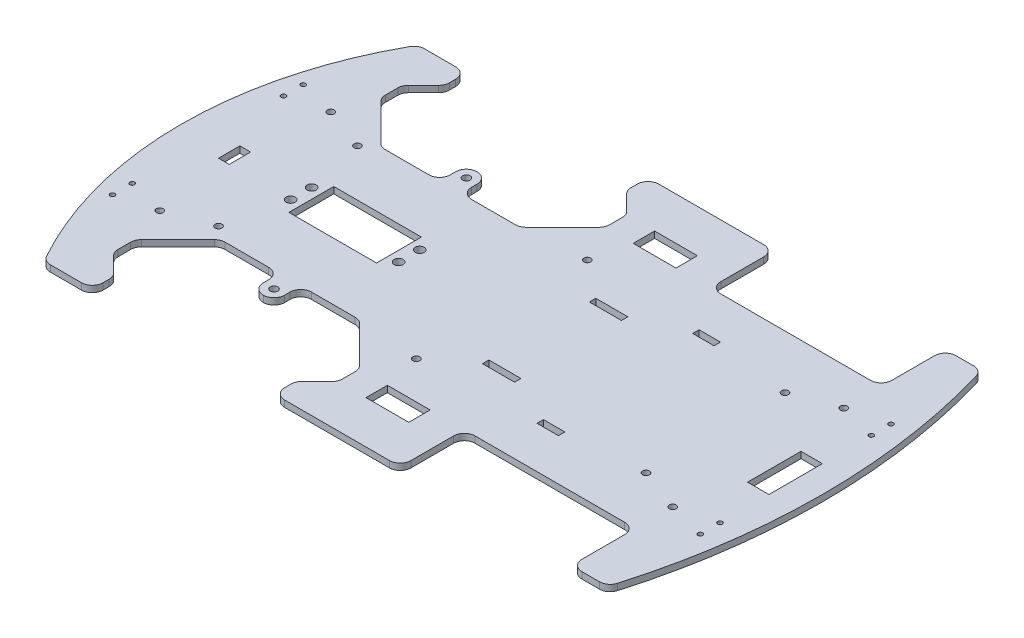
from build123d import *

# Parameters (mm, degrees)
SKETCH1_R           = 1.75
SKETCH1_R_2         = 1.6
SKETCH1_R_3         = 1.1
SKETCH1_R_4         = 2.1
SKETCH1_W           = 41
SKETCH1_H           = 21
SKETCH1_W_2         = 10
SKETCH1_H_2         = 3
SKETCH1_H_3         = 25
SKETCH1_W_3         = 15
SKETCH1_W_4         = 20
SKETCH1_H_4         = 10
SKETCH1_W_5         = 5
BOSS_EXTRUDE1_DEPTH = 3
FILLET1_R           = 5


with BuildPart() as part:
    # Sketch1 → Boss-Extrude1 (new body)
    with BuildSketch(Plane(origin=(0, 0, 0), x_dir=(1, 0, 0), z_dir=(0, 1, 0))):
        with BuildLine():
            Line((40, 87.5), (40, 57.5))
            Line((40, 57.5), (120, 57.5))
            Line((120, 57.5), (120, 87.5))
            Line((120, 87.5), (136.956007081, 87.5))
            ThreePointArc((136.956007081, 87.5), (150, 0), (136.956007081, -87.5))
            Line((136.956007081, -87.5), (120, -87.5))
            Line((120, -87.5), (120, -57.5))
            Line((120, -57.5), (40, -57.5))
            Line((40, -57.5), (40, -87.5))
            Line((40, -87.5), (-19.054445662, -87.5))
            Line((-19.054445662, -87.5), (-19.054445662, -77.5))
            Line((-19.054445662, -77.5), (-9.054445662, -67.5))
            Line((-9.054445662, -67.5), (-9.054445662, -57.465130862))
            Line((-9.054445662, -57.465130862), (-29.037011093, -37.482565431))
            Line((-29.037011093, -37.482565431), (-56.537011093, -37.482565431))
            Line((-56.537011093, -37.482565431), (-56.537011093, -50))
            Line((-56.537011093, -50), (-66.537011093, -50))
            Line((-66.537011093, -50), (-66.537011093, -37.482565431))
            Line((-66.537011093, -37.482565431), (-94.037011093, -37.482565431))
            Line((-94.037011093, -37.482565431), (-114.054445662, -57.5))
            Line((-114.054445662, -57.5), (-114.054445662, -67.5))
            Line((-114.054445662, -67.5), (-104.054445662, -77.5))
            Line((-104.054445662, -77.5), (-104.054445662, -87.5))
            Line((-104.054445662, -87.5), (-126.554445662, -87.5))
            ThreePointArc((-126.554445662, -87.5), (-150, 0), (-126.554445662, 87.5))
            Line((-126.554445662, 87.5), (-104.054445662, 87.5))
            Line((-104.054445662, 87.5), (-104.054445662, 77.5))
            Line((-104.054445662, 77.5), (-114.054445662, 67.5))
            Line((-114.054445662, 67.5), (-114.054445662, 57.5))
            Line((-114.054445662, 57.5), (-94.037011093, 37.482565431))
            Line((-94.037011093, 37.482565431), (-66.537011093, 37.482565431))
            Line((-66.537011093, 37.482565431), (-66.537011093, 50))
            Line((-66.537011093, 50), (-56.537011093, 50))
            Line((-56.537011093, 50), (-56.537011093, 37.482565431))
            Line((-56.537011093, 37.482565431), (-29.037011093, 37.482565431))
            Line((-29.037011093, 37.482565431), (-9.054445662, 57.465130862))
            Line((-9.054445662, 57.465130862), (-9.054445662, 67.5))
            Line((-9.054445662, 67.5), (-19.054445662, 77.5))
            Line((-19.054445662, 77.5), (-19.054445662, 87.5))
            Line((-19.054445662, 87.5), (40, 87.5))
        make_face()
        with Locations(Location((-61.537011093, 45, 0), (0, 0, 270))):
            Circle(SKETCH1_R, mode=Mode.SUBTRACT)
        with Locations(Location((-61.537011093, -45, 0), (0, 0, 90))):
            Circle(SKETCH1_R, mode=Mode.SUBTRACT)
        with Locations(Location((-100, 32.5, 0), (0, 0, 270))):
            Circle(SKETCH1_R_2, mode=Mode.SUBTRACT)
        with Locations(Location((100, 32.5, 0), (0, 0, 90))):
            Circle(SKETCH1_R_2, mode=Mode.SUBTRACT)
        with Locations(Location((100, -32.5, 0), (0, 0, 270))):
            Circle(SKETCH1_R_2, mode=Mode.SUBTRACT)
        with Locations(Location((-100, -32.5, 0), (0, 0, 90))):
            Circle(SKETCH1_R_2, mode=Mode.SUBTRACT)
        with Locations(Location((-120, -40, 0), (0, 0, 270))):
            Circle(SKETCH1_R_2, mode=Mode.SUBTRACT)
        with Locations(Location((0, -40, 0), (0, 0, 270))):
            Circle(SKETCH1_R_2, mode=Mode.SUBTRACT)
        with Locations(Location((120, -40, 0), (0, 0, 270))):
            Circle(SKETCH1_R_2, mode=Mode.SUBTRACT)
        with Locations(Location((120, 40, 0), (0, 0, 90))):
            Circle(SKETCH1_R_2, mode=Mode.SUBTRACT)
        with Locations(Location((0, 40, 0), (0, 0, 90))):
            Circle(SKETCH1_R_2, mode=Mode.SUBTRACT)
        with Locations(Location((-120, 40, 0), (0, 0, 90))):
            Circle(SKETCH1_R_2, mode=Mode.SUBTRACT)
        with Locations(Location((-137.5, 35.4, 0), (0, 0, 270))):
            Circle(SKETCH1_R_3, mode=Mode.SUBTRACT)
        with Locations(Location((-93.847011093, -4.925, 0), (0, 0, 270))):
            Circle(SKETCH1_R_4, mode=Mode.SUBTRACT)
        with Locations(Location((-93.847011093, 4.925, 0), (0, 0, 90))):
            Circle(SKETCH1_R_4, mode=Mode.SUBTRACT)
        with Locations(Location((-43.327011093, -4.925, 0), (0, 0, 90))):
            Circle(SKETCH1_R_4, mode=Mode.SUBTRACT)
        with Locations(Location((-43.327011093, 4.925, 0), (0, 0, 270))):
            Circle(SKETCH1_R_4, mode=Mode.SUBTRACT)
        with Locations(Location((-137.5, 44.6, 0), (0, 0, 270))):
            Circle(SKETCH1_R_3, mode=Mode.SUBTRACT)
        with Locations(Location((-137.5, -35.4, 0), (0, 0, 90))):
            Circle(SKETCH1_R_3, mode=Mode.SUBTRACT)
        with Locations(Location((-137.5, -44.6, 0), (0, 0, 90))):
            Circle(SKETCH1_R_3, mode=Mode.SUBTRACT)
        with Locations(Location((137.5, 35.4, 0), (0, 0, 90))):
            Circle(SKETCH1_R_3, mode=Mode.SUBTRACT)
        with Locations(Location((137.5, 44.6, 0), (0, 0, 90))):
            Circle(SKETCH1_R_3, mode=Mode.SUBTRACT)
        with Locations(Location((137.5, -35.4, 0), (0, 0, 270))):
            Circle(SKETCH1_R_3, mode=Mode.SUBTRACT)
        with Locations(Location((137.5, -44.6, 0), (0, 0, 270))):
            Circle(SKETCH1_R_3, mode=Mode.SUBTRACT)
        with Locations((-68.587011093, 0)):
            Rectangle(SKETCH1_W, SKETCH1_H, mode=Mode.SUBTRACT)
        with Locations((59.4, 36.4)):
            Rectangle(SKETCH1_W_2, SKETCH1_H_2, mode=Mode.SUBTRACT)
        with Locations((59.4, -36.4)):
            Rectangle(SKETCH1_W_2, SKETCH1_H_2, mode=Mode.SUBTRACT)
        with Locations((132.5, 0)):
            Rectangle(SKETCH1_W_2, SKETCH1_H_3, mode=Mode.SUBTRACT)
        with Locations((25, 25)):
            Rectangle(SKETCH1_W_3, SKETCH1_H_2, mode=Mode.SUBTRACT)
        with Locations((25, -25)):
            Rectangle(SKETCH1_W_3, SKETCH1_H_2, mode=Mode.SUBTRACT)
        with Locations((14, 62.5)):
            Rectangle(SKETCH1_W_4, SKETCH1_H_4, mode=Mode.SUBTRACT)
        with Locations((14, -62.5)):
            Rectangle(SKETCH1_W_4, SKETCH1_H_4, mode=Mode.SUBTRACT)
        with Locations((-125, 0)):
            Rectangle(SKETCH1_W_5, SKETCH1_H_4, mode=Mode.SUBTRACT)
    extrude(amount=BOSS_EXTRUDE1_DEPTH)

    # Fillet1
    fillet1_edges = [part.edges().sort_by_distance(p)[0] for p in [
        (120, 1.5, 57.5),
        (120, 1.5, -57.5),
        (40, 1.5, -57.5),
        (40, 1.5, -87.5),
        (-19.054445662, 1.5, -87.5),
        (40, 1.5, 57.5),
        (-56.537011093, 1.5, 37.482565431),
        (-56.537011093, 1.5, 50),
        (-66.537011093, 1.5, 50),
        (-66.537011093, 1.5, 37.482565431),
        (-56.537011093, 1.5, -37.482565431),
        (-56.537011093, 1.5, -50),
        (-66.537011093, 1.5, -50),
        (-66.537011093, 1.5, -37.482565431),
        (-94.037011093, 1.5, -37.482565431),
        (-126.554445662, 1.5, -87.5),
        (-126.554445662, 1.5, 87.5),
        (40, 1.5, 87.5),
        (-19.054445662, 1.5, 87.5),
        (-19.054445662, 1.5, 77.5),
        (-9.054445662, 1.5, 67.5),
        (-9.054445662, 1.5, 57.465130862),
        (-29.037011093, 1.5, 37.482565431),
        (-94.037011093, 1.5, 37.482565431),
        (-114.054445662, 1.5, 67.5),
        (-114.054445662, 1.5, 57.5),
        (-104.054445662, 1.5, 77.5),
        (-104.054445662, 1.5, 87.5),
        (-19.054445662, 1.5, -77.5),
        (-9.054445662, 1.5, -67.5),
        (-9.054445662, 1.5, -57.465130862),
        (-29.037011093, 1.5, -37.482565431),
        (-114.054445662, 1.5, -57.5),
        (-114.054445662, 1.5, -67.5),
        (-104.054445662, 1.5, -77.5),
        (-104.054445662, 1.5, -87.5),
        (120, 1.5, -87.5),
        (136.956007081, 1.5, -87.5),
        (136.956007081, 1.5, 87.5),
        (120, 1.5, 87.5),
    ]]
    fillet(fillet1_edges, radius=FILLET1_R - 0.0001)  # a hair under: the kernel refuses the full size


solid = part.part
